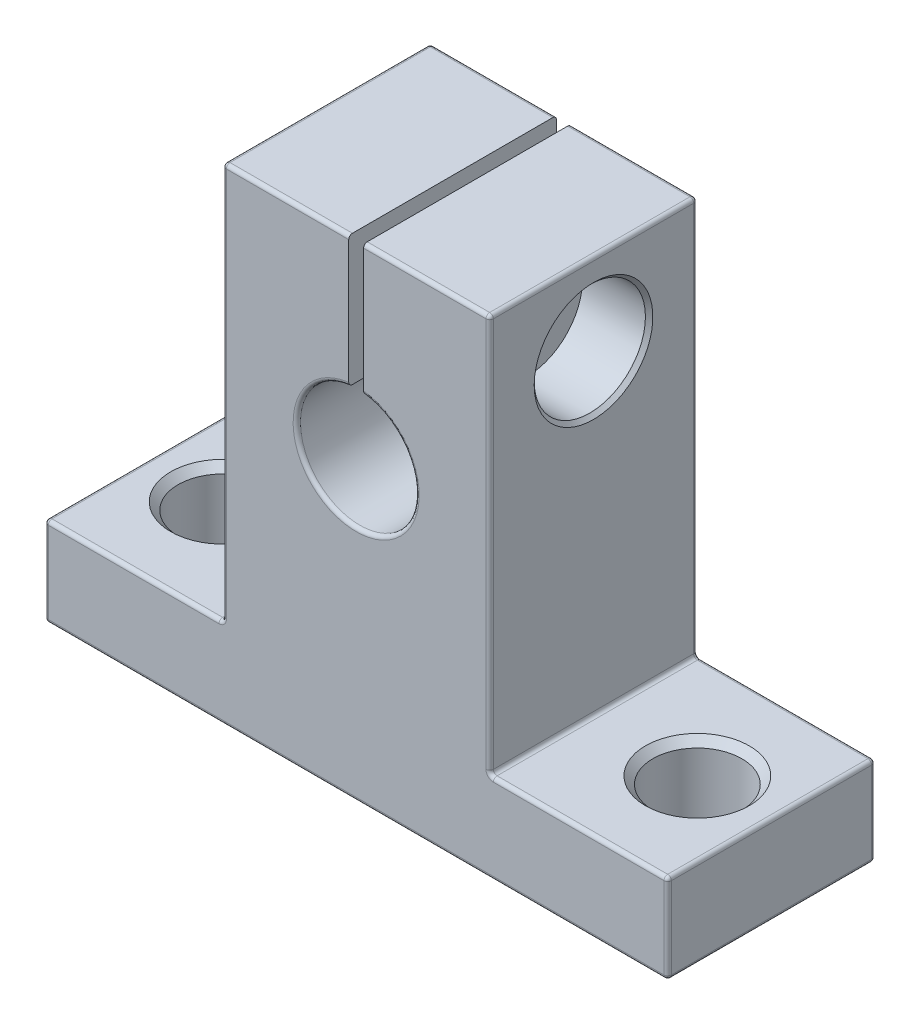
from build123d import *

# Parameters (mm, degrees)
BOSS_EXTRUDE1_DEPTH = 14
CUT_EXTRUDE1_REACH  = 53.752
SKETCH2_R           = 3
SKETCH5_R           = 2
CUT_EXTRUDE2_DEPTH  = 32
SKETCH6_R           = 3.75
CUT_EXTRUDE3_DEPTH  = 4.5
CHAMFER2_SIZE       = 0.25
FILLET1_R           = 0.25
FILLET2_R           = 0.25
CHAMFER3_SIZE       = 0.5
CHAMFER4_SIZE       = 0.5
FILLET3_R           = 0.25
FILLET4_R           = 0.25


with BuildPart() as part:
    # Sketch1 → Boss-Extrude1 (new body)
    with BuildSketch(Plane.XY):
        with BuildLine():
            Line((0, 0), (0, 6))
            Line((0, 6), (-12, 6))
            Line((-12, 6), (-12, 32.8))
            Line((-12, 32.8), (-20.5, 32.8))
            Line((-20.5, 32.8), (-20.5, 23.968626967))
            ThreePointArc((-20.5, 23.968626967), (-21, 16), (-21.5, 23.968626967))
            Line((-21.5, 23.968626967), (-21.5, 32.8))
            Line((-21.5, 32.8), (-30, 32.8))
            Line((-30, 32.8), (-30, 6))
            Line((-30, 6), (-42, 6))
            Line((-42, 6), (-42, 0))
            Line((-42, 0), (0, 0))
        make_face()
    extrude(amount=BOSS_EXTRUDE1_DEPTH)

    # Sketch2 → Cut-Extrude1 (cut, up to next)
    with BuildSketch(Plane(origin=(0, 6, 0), x_dir=(1, 0, 0), z_dir=(0, 1, 0)), mode=Mode.PRIVATE) as cut_extrude1_sk1:
        with Locations(Location((-5, -7, 0), (0, 0, 270))):
            Circle(SKETCH2_R)
    cut_extrude1_tool1 = extrude(cut_extrude1_sk1.sketch, amount=-CUT_EXTRUDE1_REACH, mode=Mode.PRIVATE) & part.part
    # Sketch2 → Cut-Extrude1 (cut, up to next)
    with BuildSketch(Plane(origin=(0, 6, 0), x_dir=(1, 0, 0), z_dir=(0, 1, 0)), mode=Mode.PRIVATE) as cut_extrude1_sk2:
        with Locations(Location((-37, -7, 0), (0, 0, 270))):
            Circle(SKETCH2_R)
    cut_extrude1_tool2 = extrude(cut_extrude1_sk2.sketch, amount=-CUT_EXTRUDE1_REACH, mode=Mode.PRIVATE) & part.part
    add(cut_extrude1_tool1.solids().sort_by_distance((-5, 6, 7))[0], mode=Mode.SUBTRACT)
    add(cut_extrude1_tool2.solids().sort_by_distance((-37, 6, 7))[0], mode=Mode.SUBTRACT)

    # Sketch5 → Cut-Extrude2 (cut)
    with BuildSketch(Plane(origin=(-12, 0, 0), x_dir=(0, 0, -1), z_dir=(1, 0, 0))):
        with Locations((-7, 27.3)):
            Circle(SKETCH5_R)
    extrude(amount=-CUT_EXTRUDE2_DEPTH, mode=Mode.SUBTRACT)

    # Sketch6 → Cut-Extrude3 (cut)
    with BuildSketch(Plane(origin=(-12, 0, 0), x_dir=(0, 0, -1), z_dir=(1, 0, 0))):
        with Locations((-7, 27.3)):
            Circle(SKETCH6_R)
    extrude(amount=-CUT_EXTRUDE3_DEPTH, mode=Mode.SUBTRACT)

    # Chamfer2
    chamfer2_edges = [part.edges().sort_by_distance(p)[0] for p in [
        (-12, 27.3, 10.75),
    ]]
    chamfer(chamfer2_edges, length=CHAMFER2_SIZE)

    # Fillet1
    fillet1_edges = [part.edges().sort_by_distance(p)[0] for p in [
        (-21, 16, 0),
        (-21, 16, 14),
    ]]
    fillet(fillet1_edges, radius=FILLET1_R)

    # Fillet2
    fillet2_edges = [part.edges().sort_by_distance(p)[0] for p in [
        (-5, 0, 4),
        (-37, 0, 4),
    ]]
    fillet(fillet2_edges, radius=FILLET2_R)

    # Chamfer3
    chamfer3_edges = [part.edges().sort_by_distance(p)[0] for p in [
        (-5, 6, 4),
        (-37, 6, 4),
    ]]
    chamfer(chamfer3_edges, length=CHAMFER3_SIZE)

    # Chamfer4
    chamfer4_edges = [part.edges().sort_by_distance(p)[0] for p in [
        (-30, 27.3, 9),
    ]]
    chamfer(chamfer4_edges, length=CHAMFER4_SIZE)

    # Fillet3
    fillet3_edges = [part.edges().sort_by_distance(p)[0] for p in [
        (-6, 6, 14),
        (-42, 3, 0),
        (-36, 6, 0),
        (-30, 19.4, 0),
        (-25.75, 32.8, 0),
        (-12, 19.4, 14),
        (-16.25, 32.8, 0),
        (-12, 19.4, 0),
        (-6, 6, 0),
        (0, 3, 0),
        (-21, 0, 0),
        (-16.25, 32.8, 14),
        (-42, 6, 7),
        (-30, 6, 7),
        (-30, 32.8, 7),
        (-12, 32.8, 7),
        (-12, 6, 7),
        (0, 6, 7),
        (0, 0, 7),
        (-25.75, 32.8, 14),
        (-30, 19.4, 14),
        (-36, 6, 14),
        (-42, 3, 14),
        (0, 3, 14),
    ]]
    fillet(fillet3_edges, radius=FILLET3_R)

    # Fillet4
    # the kernel refuses this fillet: 0.25 mm, written as the material it takes off along each edge
    with BuildSketch(Plane(origin=(-0.25, 0.25, 13.75), x_dir=(0, -1, 0), z_dir=(0, 0, 1))) as fillet4_piece_1_section:
        Polygon((0, 0), (FILLET4_R, 0), (FILLET4_R, FILLET4_R), (0, FILLET4_R), align=None)
    fillet4_piece_1 = extrude(amount=FILLET4_R, mode=Mode.PRIVATE)
    fillet4_piece_1 = fillet4_piece_1 - Plane(origin=(-0.25, 0.25, 13.75), x_dir=(-0.7071067811865475, 0.7071067811865475, 0), z_dir=(0, 0, 1)) * Sphere(FILLET4_R, mode=Mode.PRIVATE)
    add(fillet4_piece_1, mode=Mode.SUBTRACT)
    with BuildSketch(Plane(origin=(-41.75, 0.25, 0.25), x_dir=(-1, 0, 0), z_dir=(0, -1, 0))) as fillet4_piece_2_section:
        Polygon((0, 0), (FILLET4_R, 0), (FILLET4_R, FILLET4_R), (0, FILLET4_R), align=None)
    fillet4_piece_2 = extrude(amount=FILLET4_R, mode=Mode.PRIVATE)
    fillet4_piece_2 = fillet4_piece_2 - Plane(origin=(-41.75, 0.25, 0.25), x_dir=(0.7071067811865475, 0, 0.7071067811865475), z_dir=(0, -1, 0)) * Sphere(FILLET4_R, mode=Mode.PRIVATE)
    add(fillet4_piece_2, mode=Mode.SUBTRACT)
    with BuildSketch(Plane(origin=(-42, 0, 0.25), x_dir=(1, 0, 0), z_dir=(0, 0, 1))) as fillet4_piece_3:
        with BuildLine():
            CenterArc((FILLET4_R, FILLET4_R), FILLET4_R, 180, 90)
            Line((0, FILLET4_R), (0, 0))
            Line((0, 0), (FILLET4_R, 0))
        make_face()
    extrude(amount=13.5, mode=Mode.SUBTRACT)
    with BuildSketch(Plane(origin=(-41.75, 0, 13.75), x_dir=(0, 0, 1), z_dir=(1, 0, 0))) as fillet4_piece_4:
        with BuildLine():
            CenterArc((0.25 - FILLET4_R, -FILLET4_R), FILLET4_R, 0, 90)
            Line((0.25, -FILLET4_R), (0.25, 0))
            Line((0.25, 0), (0.25 - FILLET4_R, 0))
        make_face()
    revolve(axis=Axis((-41.75, 0, 13.75), (0, -1, 0)), revolution_arc=90, mode=Mode.SUBTRACT)
    with BuildSketch(Plane(origin=(-41.75, 0, 14), x_dir=(0, 1, 0), z_dir=(1, 0, 0))) as fillet4_piece_5:
        with BuildLine():
            CenterArc((FILLET4_R, -FILLET4_R), FILLET4_R, 90, 90)
            Line((0, -FILLET4_R), (0, 0))
            Line((0, 0), (FILLET4_R, 0))
        make_face()
    extrude(amount=41.5, mode=Mode.SUBTRACT)


solid = part.part
